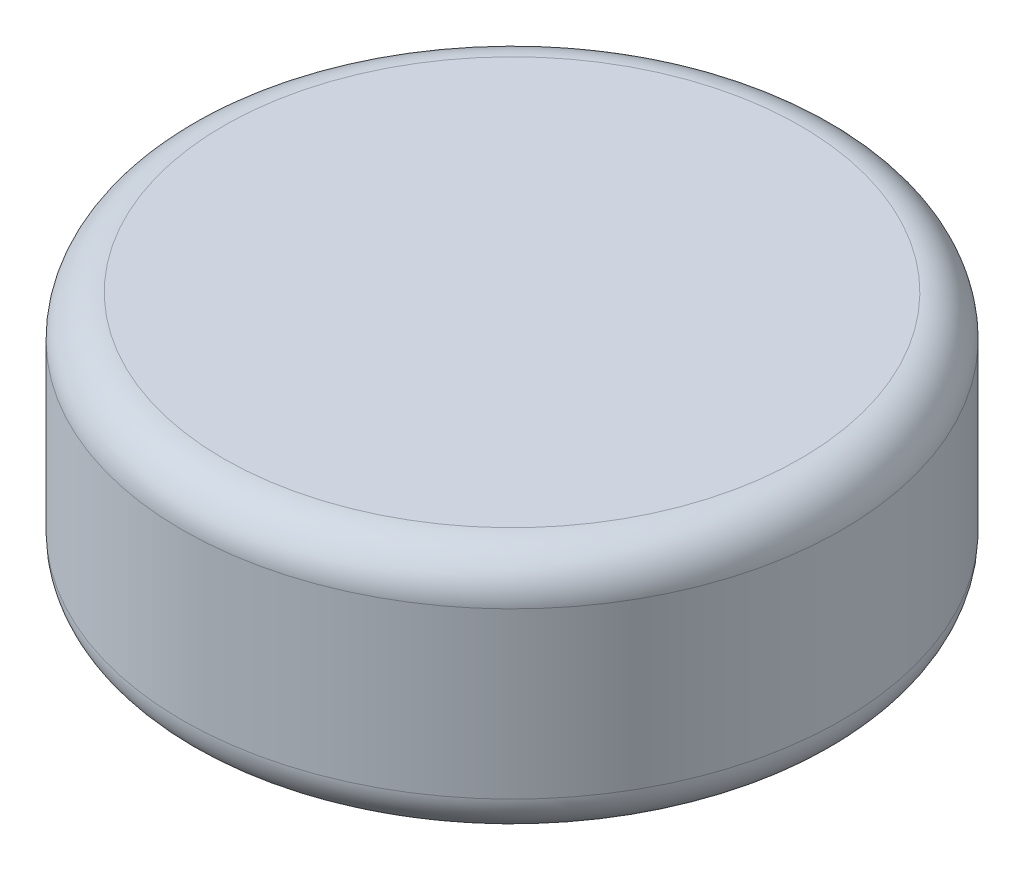
from build123d import *

# Parameters (mm, degrees)
SKETCH1_R           = 4
BOSS_EXTRUDE1_DEPTH = 3
FILLET1_R           = 0.5


with BuildPart() as part:
    # Sketch1 → Boss-Extrude1 (new body)
    with BuildSketch(Plane(origin=(0, 0, 0), x_dir=(1, 0, 0), z_dir=(0, 1, 0))):
        Circle(SKETCH1_R)
    extrude(amount=BOSS_EXTRUDE1_DEPTH)

    # Fillet1
    fillet1_edges = [part.edges().sort_by_distance(p)[0] for p in [
        (-4, 0, 0),
        (-4, 3, 0),
    ]]
    fillet(fillet1_edges, radius=FILLET1_R)


solid = part.part
